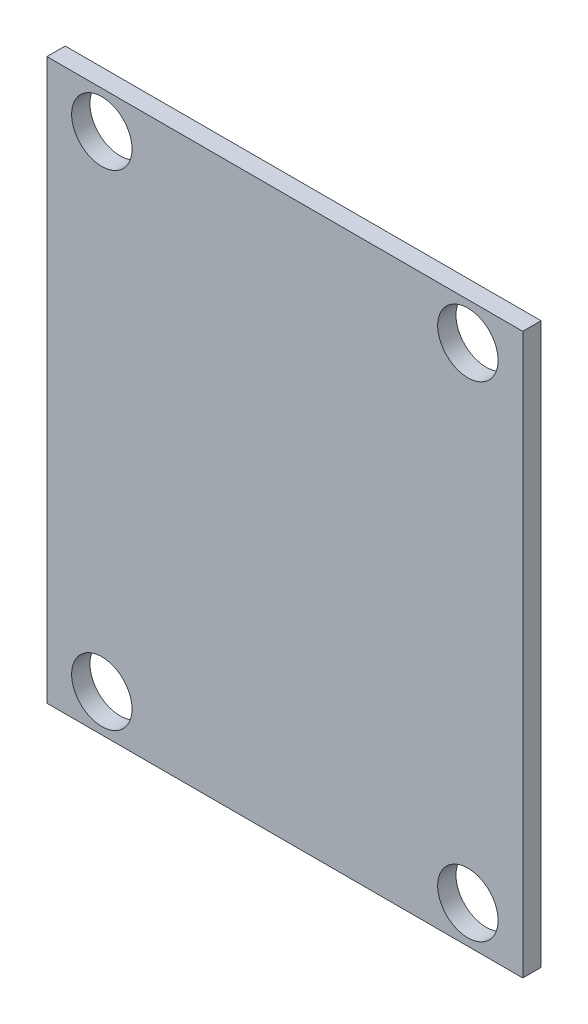
from build123d import *

# Parameters (mm, degrees)
SKETCH1_W            = 52
SKETCH1_H            = 61.2
BOSS_EXTRUDE1_DEPTH  = 2
M6_CLEARANCE_HOLE1_D = 6.6


with BuildPart() as part:
    # Sketch1 → Boss-Extrude1 (new body)
    with BuildSketch(Plane.XY):
        Rectangle(SKETCH1_W, SKETCH1_H)
    extrude(amount=BOSS_EXTRUDE1_DEPTH)

    # M6 Clearance Hole1 (through all)
    with Locations(Plane.XY.offset(2)):
        with Locations((20, -26.5), (-20, -26.5), (-20, 26.5), (20, 26.5)):
            Hole(M6_CLEARANCE_HOLE1_D / 2)


solid = part.part
